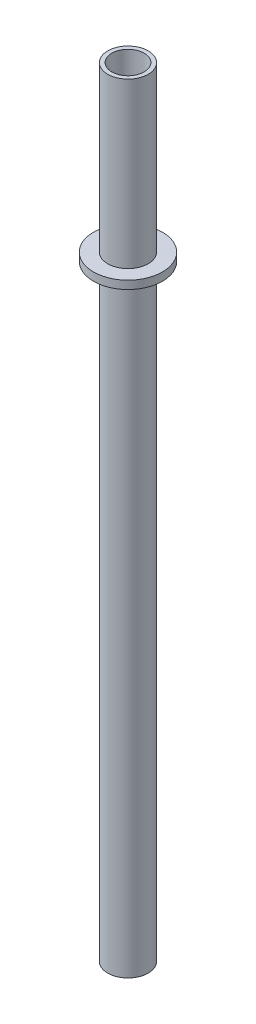
from build123d import *

# Parameters (mm, degrees)
SHAFT_EXTRUSION_DEPTH      = 134.8683866
SHAFT_EXTRUSION_DEPTH_BACK = 474.7316134
SKETCH1_R                  = 15.875
SKETCH1_R_2                = 12.7
SKETCH2_R                  = 26.9875
SKETCH2_R_2                = 15.875
BOSS_EXTRUDE1_DEPTH        = 6.35


with BuildPart() as part:
    # Sketch1 → Shaft extrusion (new, two sides: drawn at the far end of the back side and taken through both)
    with BuildSketch(Plane(origin=(0, 0, 0), x_dir=(1, 0, 0), z_dir=(0, 1, 0)).offset(-SHAFT_EXTRUSION_DEPTH_BACK)):
        Circle(SKETCH1_R)
        Circle(SKETCH1_R_2, mode=Mode.SUBTRACT)
    extrude(amount=SHAFT_EXTRUSION_DEPTH + SHAFT_EXTRUSION_DEPTH_BACK)

    # Sketch2 → Boss-Extrude1 (add)
    with BuildSketch(Plane(origin=(0, 0, 0), x_dir=(1, 0, 0), z_dir=(0, 1, 0))):
        Circle(SKETCH2_R)
        Circle(SKETCH2_R_2, mode=Mode.SUBTRACT)
    extrude(amount=BOSS_EXTRUDE1_DEPTH)


solid = part.part
